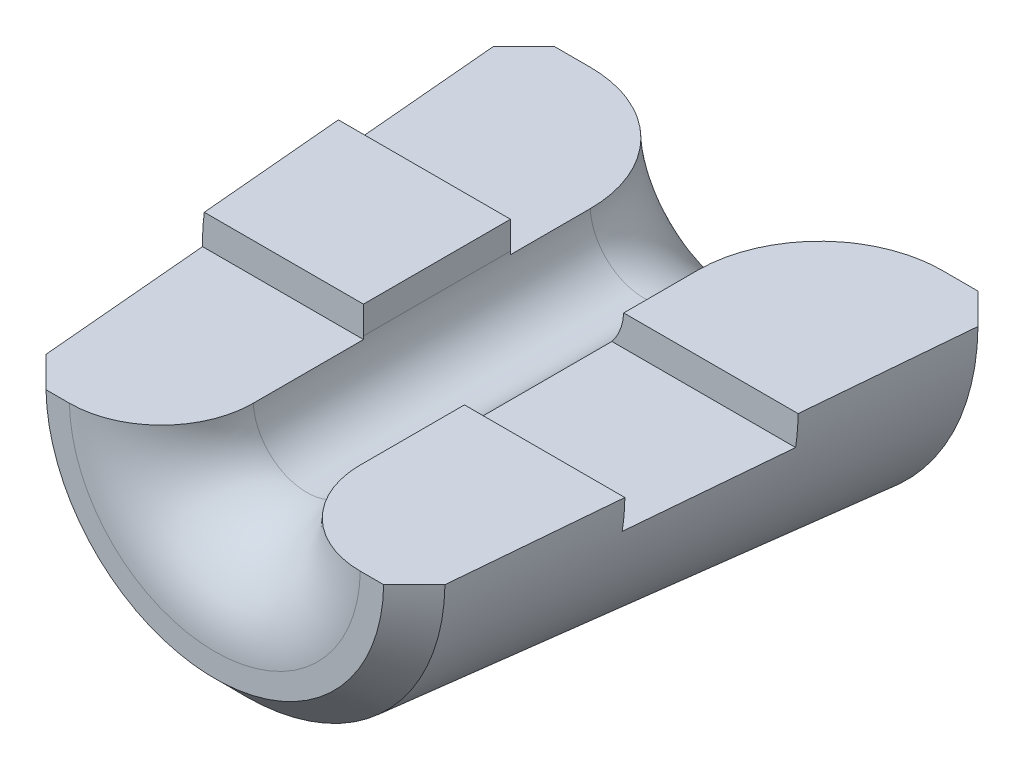
from build123d import *

# Parameters (mm, degrees)
SKETCH3_R               = 1.75
WIRE_HOLE_CUT_DEPTH     = 22.194708568
FRONT_STRAIN_FILLET_R   = 3
REAR_STRAIN_FILLET_R    = 4
SPLIT_CUT_1_DEPTH       = 22.194708568
SPLIT_CUT_2_DEPTH       = 22.194708653
WIRE_INSERT_NOTCH_DEPTH = 22.194472781


with BuildPart() as part:
    # Sketch2 → Body Revolve1 (revolve)
    with BuildSketch(Plane(origin=(0, 0, 0), x_dir=(0, 0, -1), z_dir=(1, 0, 0))):
        Polygon((0, 0), (-18, 0), (-18, 5.51269272), (-17, 6.51269272), (-1, 7.912511336), (0, 6.912511336), align=None)
    revolve(axis=Axis((0, 0, 18), (0, 0, 1)))

    # Sketch3 → Wire Hole Cut (cut, through all)
    with BuildSketch(Plane.XY):
        Circle(SKETCH3_R)
    extrude(amount=WIRE_HOLE_CUT_DEPTH, mode=Mode.SUBTRACT)

    # Front Strain Fillet
    front_strain_fillet_edges = [part.edges().sort_by_distance(p)[0] for p in [
        (-1.75, 0, 18),
    ]]
    fillet(front_strain_fillet_edges, radius=FRONT_STRAIN_FILLET_R)

    # Rear Strain Fillet
    rear_strain_fillet_edges = [part.edges().sort_by_distance(p)[0] for p in [
        (-1.75, 0, 0),
    ]]
    fillet(rear_strain_fillet_edges, radius=REAR_STRAIN_FILLET_R)

    # Sketch5 → Split Cut 1 (cut, through all)
    with BuildSketch(Plane(origin=(0, 0, 0), x_dir=(0, 0, -1), z_dir=(1, 0, 0))):
        Polygon((-18, 0), (-11.5, 0), (-11.5, 1), (-6.5, 1), (-6.5, 0), (0, 0), (0, -0.1), (-6.6, -0.1), (-6.6, 0.9), (-11.4, 0.9), (-11.4, -0.1), (-18, -0.1), align=None)
    extrude(amount=-SPLIT_CUT_1_DEPTH, mode=Mode.SUBTRACT)

    # Sketch7 → Split Cut 2 (cut, through all)
    with BuildSketch(Plane(origin=(0, 0, 0), x_dir=(0, 0, -1), z_dir=(1, 0, 0))):
        Polygon((-18, 0), (-11.5, 0), (-11.5, -1), (-6.5, -1), (-6.5, 0), (0, 0), (0, -0.1), (-6.4, -0.1), (-6.4, -1.1), (-11.6, -1.1), (-11.6, -0.1), (-18, -0.1), align=None)
    extrude(amount=SPLIT_CUT_2_DEPTH, mode=Mode.SUBTRACT)


with BuildPart() as split_cut_2_kept_piece:
    # of the separate pieces the step leaves, the one the design keeps (split_cut_2_pieces_kept)
    add(part.part.solids().sort_by_distance((-1.747140521, -0.1, 4))[0])

    # Sketch6 → Wire Insert Notch (cut, through all)
    with BuildSketch(Plane.XY):
        with BuildLine():
            Line((-1.75, 0), (-1.75, 2))
            Line((-1.75, 2), (1.75, 2))
            Line((1.75, 2), (1.75, 0))
            ThreePointArc((1.75, 0), (0, -1.75), (-1.75, 0))
        make_face()
    extrude(amount=WIRE_INSERT_NOTCH_DEPTH, mode=Mode.SUBTRACT)


solid = split_cut_2_kept_piece.part
